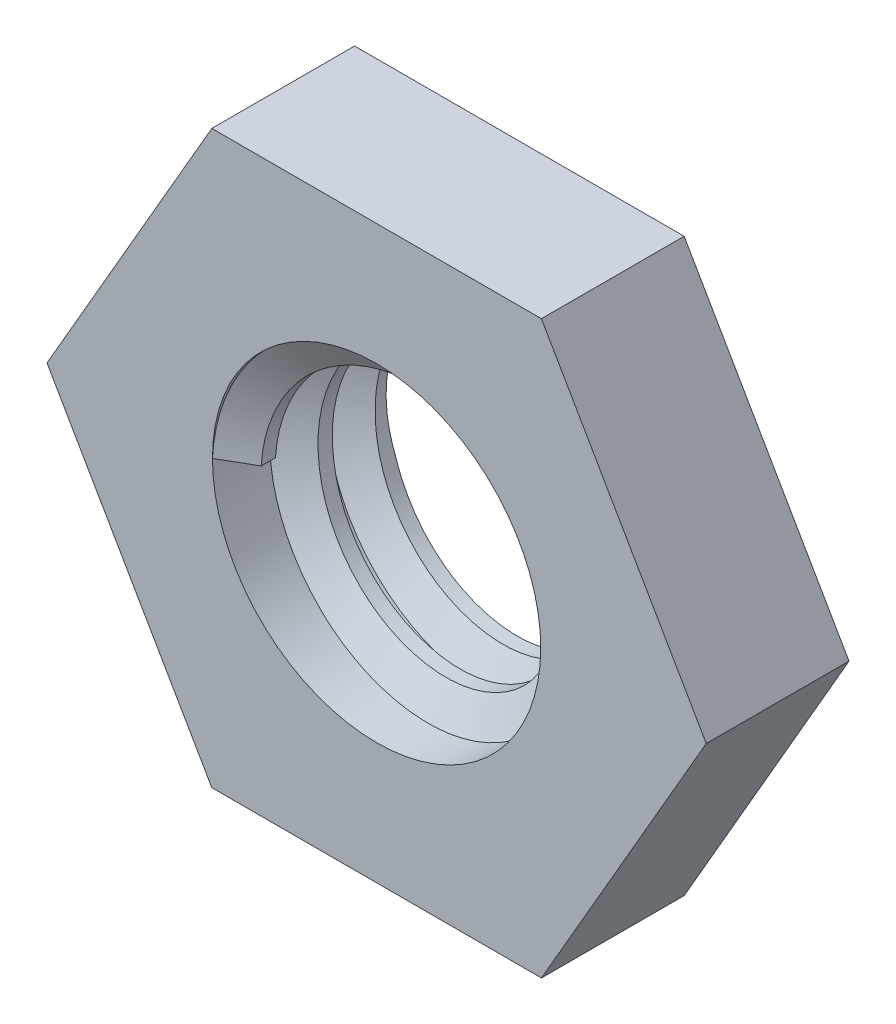
from build123d import *

# Parameters (mm, degrees)
AUFSATZ_LINEAR_AUSTRAGEN1_DEPTH   = 5
GEWINDEBOHRUNG_F_R_PG7_F_HRUNG1_D = 11.5
GEWINDE1_PITCH                    = 2
SKIZZE12_W                        = 16.387995399
SKIZZE12_H                        = 16.357045455
SCHNITT_LINEAR_AUSTRAGEN1_DEPTH   = 10


with BuildPart() as part:
    # Skizze1 → Aufsatz-Linear austragen1 (new body)
    with BuildSketch(Plane.XY):
        Polygon((0, 0), (11.545, 0), (17.319505384, -10.001736713), (11.547005384, -20), (-0.002005384, -20), (-5.774505384, -10.001736713), align=None)
    extrude(amount=AUFSATZ_LINEAR_AUSTRAGEN1_DEPTH)

    # Gewindebohrung für Pg7 Führung1 (through all)
    with Locations(Plane(origin=(5.771497308, -10, 5), x_dir=(1, 0, 0), z_dir=(0, 0, 1))):
        with Locations((0, 0)):
            Hole(GEWINDEBOHRUNG_F_R_PG7_F_HRUNG1_D / 2)

    # Gewinde1: the profile of Gewindeprofil2 profile screwed along a right-hand helix of 5 turns, 10 arcs to a turn; built about Z, then put on its axis
    gewinde1_z = Axis((0, 0, 0), (0, 0, 1))
    gewinde1_corners = [(5.7503, 0, -0.000173205), (5.7503, 0, 1.7501732), (4.66746825, 0, 1.124999997), (4.66746825, 0, 0.624999997)]
    with BuildLine(mode=Mode.PRIVATE) as gewinde1_profile:
        Line(gewinde1_corners[0], gewinde1_corners[1])
        Line(gewinde1_corners[1], gewinde1_corners[2])
        Line(gewinde1_corners[2], gewinde1_corners[3])
        Line(gewinde1_corners[3], gewinde1_corners[0])
    gewinde1_cap = Face(gewinde1_profile.wire())
    gewinde1_turn_angles = [0, 18, 36, 54, 72, 90, 108, 126, 144, 162, 180, 198, 216, 234, 252, 270, 288, 306, 324, 342, 360]
    gewinde1_turn_weights = [1, 0.9510565162951535, 1, 0.9510565162951535, 1, 0.9510565162951535, 1, 0.9510565162951535, 1, 0.9510565162951535, 1, 0.9510565162951535, 1, 0.9510565162951535, 1, 0.9510565162951535, 1, 0.9510565162951535, 1, 0.9510565162951535, 1]
    gewinde1_turn_rails = [Edge.make_bspline([Vector(p[0], p[1], 0).rotate(gewinde1_z, gewinde1_turn_angles[k]) / gewinde1_turn_weights[k] + Vector(0, 0, p[2] + GEWINDE1_PITCH * gewinde1_turn_angles[k] / 360) for k in range(21)], [0, 0, 0, 1, 1, 2, 2, 3, 3, 4, 4, 5, 5, 6, 6, 7, 7, 8, 8, 9, 9, 10, 10, 10], 2, gewinde1_turn_weights) for p in gewinde1_corners]
    gewinde1_turn_sides = [Face.make_surface_from_curves(gewinde1_turn_rails[p[0]], gewinde1_turn_rails[p[1]]) for p in [(0, 1), (1, 2), (2, 3), (3, 0)]]
    gewinde1 = Plane(origin=(5.771497308, -10, 5), x_dir=(-1, 0, 0), z_dir=(0, 0, -1)) * Solid(Shell([*[p.moved(Location((0, 0, GEWINDE1_PITCH * i))) for i in range(5) for p in gewinde1_turn_sides], gewinde1_cap, gewinde1_cap.rotate(gewinde1_z, 1800).moved(Location((0, 0, GEWINDE1_PITCH * 1800 / 360)))]))
    add(gewinde1)

    # Skizze12 → Schnitt-Linear austragen1 (cut)
    with BuildSketch(Plane(origin=(0, 0, 0), x_dir=(-1, 0, 0), z_dir=(0, 0, -1))):
        with Locations((-5.65643771, -10.147012235)):
            Rectangle(SKIZZE12_W, SKIZZE12_H)
    extrude(amount=SCHNITT_LINEAR_AUSTRAGEN1_DEPTH, mode=Mode.SUBTRACT)


solid = part.part
